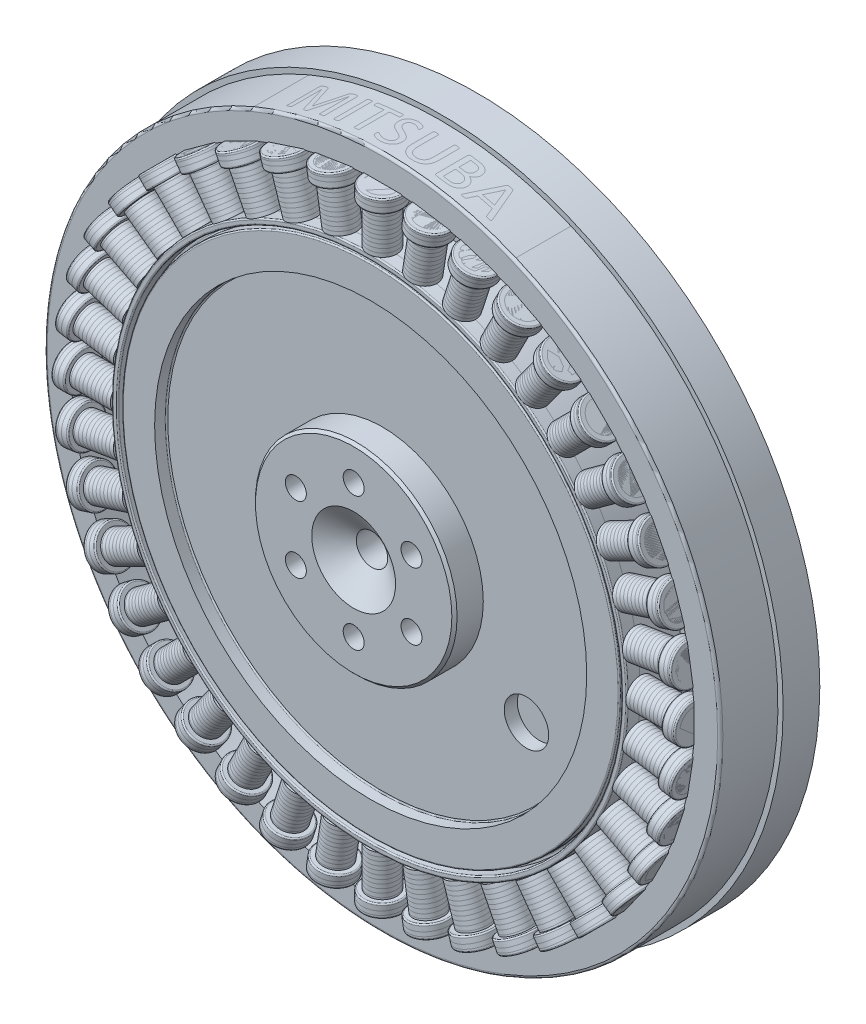
from build123d import *

# Parameters (mm, degrees)
IZIM1_R                      = 131
Y_KSEKLIK_EKSTR_ZYON1_DEPTH  = 36
IZIM2_R                      = 156.861229325
IZIM2_R_2                    = 129
KES_EKSTR_ZYON1_DEPTH        = 22
IZIM3_R                      = 47
Y_KSEKLIK_EKSTR_ZYON2_DEPTH  = 21.5
IZIM4_R                      = 36.5
Y_KSEKLIK_EKSTR_ZYON3_DEPTH  = 12.5
PAH1_SIZE                    = 1
IZIM5_R                      = 28.5
KES_EKSTR_ZYON2_DEPTH        = 11
RADYUS1_R                    = 2
PAH2_SIZE                    = 1
IZIM6_R                      = 19
Y_KSEKLIK_EKSTR_ZYON4_DEPTH  = 10
IZIM7_R                      = 8
KES_EKSTR_ZYON3_DEPTH        = 30
PAH3_SIZE                    = 1
IZIM8_W                      = 3
IZIM8_H                      = 5.258861321
IZIM8_W_2                    = 4.020112213
IZIM8_H_2                    = 3
IZIM8_W_3                    = 5.493724989
KES_EKSTR_ZYON5_DEPTH        = 10
IZIM9_R                      = 10.901402215
IZIM9_R_2                    = 9.478132464
KES_EKSTR_ZYON6_DEPTH        = 2
IZIM10_R                     = 4
Y_KSEKLIK_EKSTR_ZYON5_DEPTH  = 4
IZIM11_R                     = 1.5
KES_EKSTR_ZYON7_DEPTH        = 1
RADYUS2_R                    = 1.5
RADYUS3_R                    = 0.5
PAH4_SIZE                    = 1
RADYUS4_R                    = 1
IZIM12_R                     = 95
IZIM12_R_2                   = 82.5
Y_KSEKLIK_EKSTR_ZYON6_DEPTH  = 4.5
RADYUS5_R                    = 0.5
IZIM13_R                     = 38.5
Y_KSEKLIK_EKSTR_ZYON7_DEPTH  = 11
PAH5_SIZE                    = 1
IZIM14_R                     = 4
KES_EKSTR_ZYON8_DEPTH        = 11
IZIM15_R                     = 6
KES_EKSTR_ZYON9_DEPTH        = 142
IZIM23_R                     = 119
IZIM23_R_2                   = 98.417839378
KES_EKSTR_ZYON10_DEPTH       = 16
IZIM24_W                     = 5.5
IZIM24_H                     = 20.582160622
IZIM25_R                     = 7.5
Y_KSEKLIK_EKSTR_ZYON9_DEPTH  = 5
RADYUS6_R                    = 0.5
DAIRESEL_KAPLAMA2_COUNT      = 40
DAIRESEL_KAPLAMA2_2_COUNT    = 40
IZIM27_R                     = 98.417839378
IZIM27_R_2                   = 96.233627016
Y_KSEKLIK_EKSTR_ZYON11_DEPTH = 5
RADYUS7_R                    = 0.5
IZIM28_R                     = 8.5
KES_EKSTR_ZYON11_DEPTH       = 5


with BuildPart() as part:
    # Çizim1 → Yükseklik-Ekstrüzyon1 (new body)
    with BuildSketch(Plane.XY):
        Circle(IZIM1_R)
    extrude(amount=Y_KSEKLIK_EKSTR_ZYON1_DEPTH)

    # Çizim2 → Kes-Ekstrüzyon1 (cut)
    with BuildSketch(Plane.XY.offset(36)):
        Circle(IZIM2_R)
        Circle(IZIM2_R_2, mode=Mode.SUBTRACT)
    extrude(amount=-KES_EKSTR_ZYON1_DEPTH, mode=Mode.SUBTRACT)

    # Çizim3 → Yükseklik-Ekstrüzyon2 (add)
    with BuildSketch(Plane(origin=(0, 0, 0), x_dir=(-1, 0, 0), z_dir=(0, 0, -1))):
        with Locations(Location((0, 0, 0), (0, 0, 180))):
            Circle(IZIM3_R)
    extrude(amount=Y_KSEKLIK_EKSTR_ZYON2_DEPTH)

    # Çizim4 → Yükseklik-Ekstrüzyon3 (add)
    with BuildSketch(Plane(origin=(0, 0, -21.5), x_dir=(-1, 0, 0), z_dir=(0, 0, -1))):
        Circle(IZIM4_R)
    extrude(amount=Y_KSEKLIK_EKSTR_ZYON3_DEPTH)

    # Pah1
    pah1_edges = [part.edges().sort_by_distance(p)[0] for p in [
        (36.5, 0, -34),
    ]]
    chamfer(pah1_edges, length=PAH1_SIZE)

    # Çizim5 → Kes-Ekstrüzyon2 (cut)
    with BuildSketch(Plane(origin=(0, 0, -34), x_dir=(-1, 0, 0), z_dir=(0, 0, -1))):
        Circle(IZIM5_R)
    extrude(amount=-KES_EKSTR_ZYON2_DEPTH, mode=Mode.SUBTRACT)

    # Radyus1
    radyus1_edges = [part.edges().sort_by_distance(p)[0] for p in [
        (28.5, 0, -23),
    ]]
    fillet(radyus1_edges, radius=RADYUS1_R)

    # Pah2
    pah2_edges = [part.edges().sort_by_distance(p)[0] for p in [
        (28.5, 0, -34),
    ]]
    chamfer(pah2_edges, length=PAH2_SIZE)

    # Çizim6 → Yükseklik-Ekstrüzyon4 (add)
    with BuildSketch(Plane(origin=(0, 0, -23), x_dir=(-1, 0, 0), z_dir=(0, 0, -1))):
        Circle(IZIM6_R)
    extrude(amount=Y_KSEKLIK_EKSTR_ZYON4_DEPTH)

    # Çizim7 → Kes-Ekstrüzyon3 (cut)
    with BuildSketch(Plane(origin=(0, 0, -33), x_dir=(-1, 0, 0), z_dir=(0, 0, -1))):
        Circle(IZIM7_R)
    extrude(amount=-KES_EKSTR_ZYON3_DEPTH, mode=Mode.SUBTRACT)

    # Pah3
    pah3_edges = [part.edges().sort_by_distance(p)[0] for p in [
        (19, 0, -33),
    ]]
    chamfer(pah3_edges, length=PAH3_SIZE)

    # Çizim8 → Kes-Ekstrüzyon5 (cut)
    with BuildSketch(Plane(origin=(0, 0, -33), x_dir=(-1, 0, 0), z_dir=(0, 0, -1))):
        with BuildLine():
            ThreePointArc((1.502, -17.938307462), (0.00200349, -18.000999972), (-1.498, -17.938474711))
            Line((-1.498, -17.938474711), (-1.498, -20.971589699))
            Line((-1.498, -20.971589699), (1.502, -20.971589699))
            Line((1.502, -20.971589699), (1.502, -17.938307462))
        make_face()
        with Locations((0, 19.62943066)):
            Rectangle(IZIM8_W, IZIM8_H)
        with Locations((19.011056106, 0.001)):
            Rectangle(IZIM8_W_2, IZIM8_H_2)
        with Locations((-19.745862495, -0.001)):
            Rectangle(IZIM8_W_3, IZIM8_H_2)
    extrude(amount=-KES_EKSTR_ZYON5_DEPTH, mode=Mode.SUBTRACT)

    # Çizim9 → Kes-Ekstrüzyon6 (cut)
    with BuildSketch(Plane(origin=(0, 0, -33), x_dir=(-1, 0, 0), z_dir=(0, 0, -1))):
        Circle(IZIM9_R)
        Circle(IZIM9_R_2, mode=Mode.SUBTRACT)
    extrude(amount=-KES_EKSTR_ZYON6_DEPTH, mode=Mode.SUBTRACT)

    # Çizim10 → Yükseklik-Ekstrüzyon5 (add)
    with BuildSketch(Plane(origin=(0, 0, 0), x_dir=(-1, 0, 0), z_dir=(0, 0, -1))):
        with Locations(Location((0, 58, 0), (0, 0, 180))):
            Circle(IZIM10_R)
        with Locations(Location((50.229473419, 29, 0), (0, 0, 180))):
            Circle(IZIM10_R)
        with Locations(Location((50.22947342, -29, 0), (0, 0, 180))):
            Circle(IZIM10_R)
        with Locations(Location((0, -58, 0), (0, 0, 180))):
            Circle(IZIM10_R)
        with Locations(Location((-50.229473419, -29, 0), (0, 0, 180))):
            Circle(IZIM10_R)
        with Locations(Location((-50.229473419, 29, 0), (0, 0, 180))):
            Circle(IZIM10_R)
    extrude(amount=Y_KSEKLIK_EKSTR_ZYON5_DEPTH)

    # Çizim11 → Kes-Ekstrüzyon7 (cut)
    with BuildSketch(Plane(origin=(0, 0, -4), x_dir=(-1, 0, 0), z_dir=(0, 0, -1))):
        with Locations((0, 58)):
            Circle(IZIM11_R)
        with Locations((50.229473419, 29)):
            Circle(IZIM11_R)
        with Locations((50.22947342, -29)):
            Circle(IZIM11_R)
        with Locations((0, -58)):
            Circle(IZIM11_R)
        with Locations((-50.229473419, -29)):
            Circle(IZIM11_R)
        with Locations((-50.229473419, 29)):
            Circle(IZIM11_R)
    extrude(amount=-KES_EKSTR_ZYON7_DEPTH, mode=Mode.SUBTRACT)

    # Radyus2
    radyus2_edges = [part.edges().sort_by_distance(p)[0] for p in [
        (-4, 58, -4),
        (-54.229473419, 29, -4),
        (-54.22947342, -29, -4),
        (-4, -58, -4),
        (46.229473419, -29, -4),
        (46.229473419, 29, -4),
    ]]
    fillet(radyus2_edges, radius=RADYUS2_R)

    # Radyus3
    radyus3_edges = [part.edges().sort_by_distance(p)[0] for p in [
        (1.5, 58, -4),
        (-48.729473419, 29, -4),
        (-48.729473419, -29, -3),
        (1.5, -58, -4),
        (51.729473419, -29, -4),
        (51.729473419, 29, -4),
    ]]
    fillet(radyus3_edges, radius=RADYUS3_R)

    # Pah4
    pah4_edges = [part.edges().sort_by_distance(p)[0] for p in [
        (-47, 0, -21.5),
    ]]
    chamfer(pah4_edges, length=PAH4_SIZE)

    # Radyus4
    radyus4_edges = [part.edges().sort_by_distance(p)[0] for p in [
        (-129, 0, 36),
    ]]
    fillet(radyus4_edges, radius=RADYUS4_R)

    # Çizim12 → Yükseklik-Ekstrüzyon6 (add)
    with BuildSketch(Plane.XY.offset(36)):
        Circle(IZIM12_R)
        Circle(IZIM12_R_2, mode=Mode.SUBTRACT)
    extrude(amount=Y_KSEKLIK_EKSTR_ZYON6_DEPTH)

    # Radyus5
    radyus5_edges = [part.edges().sort_by_distance(p)[0] for p in [
        (-82.5, 0, 36),
        (-95, 0, 40.5),
        (-95, 0, 36),
    ]]
    fillet(radyus5_edges, radius=RADYUS5_R)

    # Çizim13 → Yükseklik-Ekstrüzyon7 (add)
    with BuildSketch(Plane.XY.offset(36)):
        Circle(IZIM13_R)
    extrude(amount=Y_KSEKLIK_EKSTR_ZYON7_DEPTH)

    # Pah5
    pah5_edges = [part.edges().sort_by_distance(p)[0] for p in [
        (-38.5, 0, 47),
    ]]
    chamfer(pah5_edges, length=PAH5_SIZE)

    # Çizim14 → Kes-Ekstrüzyon8 (cut)
    with BuildSketch(Plane.XY.offset(47)):
        with Locations((0, 25.48572025)):
            Circle(IZIM14_R)
        with Locations((22.07128117, 12.742860125)):
            Circle(IZIM14_R)
        with Locations((22.07128117, -12.742860125)):
            Circle(IZIM14_R)
        with Locations((0, -25.48572025)):
            Circle(IZIM14_R)
        with Locations((-22.07128117, -12.742860125)):
            Circle(IZIM14_R)
        with Locations((-22.07128117, 12.742860125)):
            Circle(IZIM14_R)
    extrude(amount=-KES_EKSTR_ZYON8_DEPTH, mode=Mode.SUBTRACT)

    # Çizim15 → Kes-Ekstrüzyon9 (cut)
    with BuildSketch(Plane.XY.offset(47)):
        Circle(IZIM15_R)
    extrude(amount=-KES_EKSTR_ZYON9_DEPTH, mode=Mode.SUBTRACT)

    # Çizim16 → Kes-Döndür1 (revolve, cut)
    with BuildSketch(Plane(origin=(0, 0, 0), x_dir=(0, 0, -1), z_dir=(1, 0, 0)), mode=Mode.PRIVATE) as kes_d_nd_r1_sk:
        Polygon((-47, 0), (-40, 0), (-40, 6), (-47, 16), align=None)
    revolve(kes_d_nd_r1_sk.sketch.rotate(Axis((0, 0, 40), (0, 0, -1)), 90), axis=Axis((0, 0, 40), (0, 0, -1)), mode=Mode.SUBTRACT)

    # Çizim23 → Kes-Ekstrüzyon10 (cut)
    with BuildSketch(Plane.XY.offset(36)):
        Circle(IZIM23_R)
        Circle(IZIM23_R_2, mode=Mode.SUBTRACT)
    extrude(amount=-KES_EKSTR_ZYON10_DEPTH, mode=Mode.SUBTRACT)

    # Çizim28 → Kes-Ekstrüzyon11 (cut)
    with BuildSketch(Plane.XY.offset(36)):
        with Locations((54.99261314, -31.75)):
            Circle(IZIM28_R)
    extrude(amount=-KES_EKSTR_ZYON11_DEPTH, mode=Mode.SUBTRACT)


with BuildPart() as body_2:
    # Çizim24 → Döndür4 (revolve)
    with BuildSketch(Plane(origin=(0, 0, 0), x_dir=(0, 0, -1), z_dir=(1, 0, 0)), mode=Mode.PRIVATE) as d_nd_r4_sk:
        with Locations((-38.75, 108.708919689)):
            Rectangle(IZIM24_W, IZIM24_H)
    revolve(d_nd_r4_sk.sketch.rotate(Axis((0, 119, 36), (0, 1, 0)), 180), axis=Axis((0, 119, 36), (0, 1, 0)))

    # Dairesel Kaplama2 2: body 2 ×40 about axis
    dairesel_kaplama2_2_axis = Axis((0, 0, 0), (0, 0, 1))


with BuildPart() as body_3:
    # Çizim25 → Yükseklik-Ekstrüzyon9 (new body)
    with BuildSketch(Plane(origin=(0, 119, 0), x_dir=(1, 0, 0), z_dir=(0, 1, 0))):
        with Locations(Location((0, -36, 0), (0, 0, 270))):
            Circle(IZIM25_R)
    extrude(amount=-Y_KSEKLIK_EKSTR_ZYON9_DEPTH)

    # Radyus6
    radyus6_edges = [body_3.edges().sort_by_distance(p)[0] for p in [
        (0, 119, 28.5),
        (0, 114, 28.5),
    ]]
    fillet(radyus6_edges, radius=RADYUS6_R)

    # Dairesel Kaplama2: body 3 ×40 about axis
    dairesel_kaplama2_axis = Axis((0, 0, 0), (0, 0, 1))


with BuildPart() as body_3_1:
    add(body_3.part)
    for i in range(1, DAIRESEL_KAPLAMA2_COUNT):
        add(body_3.part.rotate(dairesel_kaplama2_axis, i * 360 / DAIRESEL_KAPLAMA2_COUNT))


with BuildPart() as body_2_1:
    add(body_2.part)
    for i in range(1, DAIRESEL_KAPLAMA2_2_COUNT):
        add(body_2.part.rotate(dairesel_kaplama2_2_axis, i * 360 / DAIRESEL_KAPLAMA2_2_COUNT))


with BuildPart() as body_4:
    # Çizim27 → Yükseklik-Ekstrüzyon11 (new body)
    with BuildSketch(Plane.XY.offset(36)):
        Circle(IZIM27_R)
        Circle(IZIM27_R_2, mode=Mode.SUBTRACT)
    extrude(amount=Y_KSEKLIK_EKSTR_ZYON11_DEPTH)

    # Radyus7
    radyus7_edges = [body_4.edges().sort_by_distance(p)[0] for p in [
        (-98.417839378, 0, 41),
        (-96.233627016, 0, 36),
        (-96.233627016, 0, 41),
    ]]
    fillet(radyus7_edges, radius=RADYUS7_R)


solid = Compound([part.part, body_3_1.part, body_2_1.part, body_4.part])
